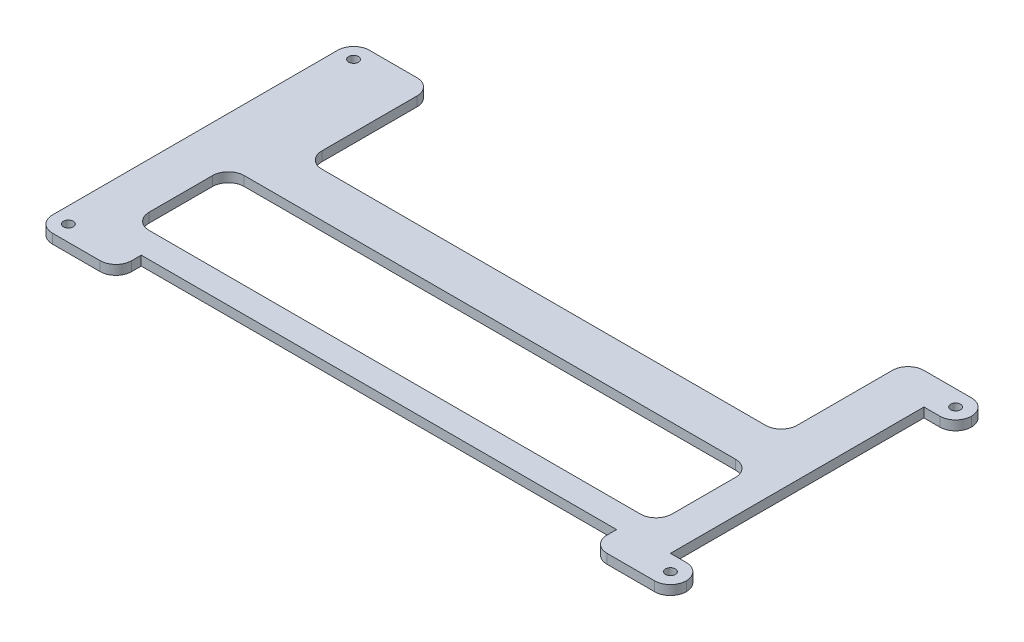
from build123d import *

# Parameters (mm, degrees)
SKETCH1_W           = 200
SKETCH1_H           = 100
BOSS_EXTRUDE1_DEPTH = 3
SKETCH2_R           = 1.55
CUT_EXTRUDE1_DEPTH  = 112.843640856
FILLET1_R           = 5
SKETCH3_W           = 150
SKETCH3_H           = 40
SKETCH3_W_2         = 10
SKETCH3_H_2         = 80
SKETCH3_H_3         = 8
SKETCH3_W_3         = 165
SKETCH3_H_4         = 30
CUT_EXTRUDE2_DEPTH  = 112.843640856
FILLET2_START       = -1
FILLET2_DEPTH       = 5
FILLET2_2_DEPTH     = 3


with BuildPart() as part:
    # Sketch1 → Boss-Extrude1 (new body)
    with BuildSketch(Plane(origin=(0, 0, 0), x_dir=(1, 0, 0), z_dir=(0, 1, 0))):
        Rectangle(SKETCH1_W, SKETCH1_H)
    extrude(amount=BOSS_EXTRUDE1_DEPTH)

    # Sketch2 → Cut-Extrude1 (cut, through all)
    with BuildSketch(Plane(origin=(0, 3, 0), x_dir=(1, 0, 0), z_dir=(0, 1, 0))):
        with Locations(Location((-95, 45, 0), (0, 0, 270))):
            Circle(SKETCH2_R)
        with Locations(Location((-95, -45, 0), (0, 0, 270))):
            Circle(SKETCH2_R)
        with Locations(Location((95, 45, 0), (0, 0, 270))):
            Circle(SKETCH2_R)
        with Locations(Location((95, -45, 0), (0, 0, 270))):
            Circle(SKETCH2_R)
    extrude(amount=-CUT_EXTRUDE1_DEPTH, mode=Mode.SUBTRACT)

    # Fillet1
    fillet1_edges = [part.edges().sort_by_distance(p)[0] for p in [
        (-100, 1.5, -50),
        (100, 1.5, -50),
        (100, 1.5, 50),
        (-100, 1.5, 50),
    ]]
    fillet(fillet1_edges, radius=FILLET1_R)

    # Sketch3 → Cut-Extrude2 (cut, through all)
    with BuildSketch(Plane(origin=(0, 3, 0), x_dir=(1, 0, 0), z_dir=(0, 1, 0))):
        with Locations((0, 30)):
            Rectangle(SKETCH3_W, SKETCH3_H)
        with Locations((95, 0)):
            Rectangle(SKETCH3_W_2, SKETCH3_H_2)
        with Locations((0, -46)):
            Rectangle(SKETCH3_W, SKETCH3_H_3)
        with Locations((-3, -19)):
            Rectangle(SKETCH3_W_3, SKETCH3_H_4)
    extrude(amount=-CUT_EXTRUDE2_DEPTH, mode=Mode.SUBTRACT)

    # Fillet2: read off the stored shape, not the designer's step
    # Fillet2 outline → Fillet2 (cut)
    with BuildSketch(Plane(origin=(0, 0, 0), x_dir=(1, 0, 0), z_dir=(0, 1, 0)).offset(FILLET2_START)):
        with BuildLine():
            Line((100, 40), (100, 45))
            ThreePointArc((100, 45), (98.535533906, 41.464466094), (95, 40))
            Line((95, 40), (100, 40))
        make_face()
        with BuildLine():
            ThreePointArc((-80, 50), (-76.464466094, 48.535533906), (-75, 45))
            Line((-75, 45), (-75, 50))
            Line((-75, 50), (-80, 50))
        make_face()
        with BuildLine():
            ThreePointArc((75, 45), (76.464466094, 48.535533906), (80, 50))
            Line((80, 50), (75, 50))
            Line((75, 50), (75, 45))
        make_face()
        with BuildLine():
            Line((100, -40), (95, -40))
            ThreePointArc((95, -40), (98.535533906, -41.464466094), (100, -45))
            Line((100, -45), (100, -40))
        make_face()
        with BuildLine():
            Line((75, -50), (80, -50))
            ThreePointArc((80, -50), (76.464466094, -48.535533906), (75, -45))
            Line((75, -45), (75, -50))
        make_face()
        with BuildLine():
            ThreePointArc((-75, -45), (-76.464466094, -48.535533906), (-80, -50))
            Line((-80, -50), (-75, -50))
            Line((-75, -50), (-75, -45))
        make_face()
    extrude(amount=FILLET2_DEPTH, mode=Mode.SUBTRACT)

    # Fillet2 2 outline → Fillet2 2 (add)
    with BuildSketch(Plane(origin=(0, 0, 0), x_dir=(1, 0, 0), z_dir=(0, 1, 0))):
        with BuildLine():
            Line((-75, 10), (-70, 10))
            ThreePointArc((-70, 10), (-73.535533906, 11.464466094), (-75, 15))
            Line((-75, 15), (-75, 10))
        make_face()
        with BuildLine():
            Line((75, 10), (75, 15))
            ThreePointArc((75, 15), (73.535533906, 11.464466094), (70, 10))
            Line((70, 10), (75, 10))
        make_face()
        with BuildLine():
            Line((79.5, -34), (79.5, -29))
            ThreePointArc((79.5, -29), (78.035533906, -32.535533906), (74.5, -34))
            Line((74.5, -34), (79.5, -34))
        make_face()
        with BuildLine():
            ThreePointArc((74.5, -4), (78.035533906, -5.464466094), (79.5, -9))
            Line((79.5, -9), (79.5, -4))
            Line((79.5, -4), (74.5, -4))
        make_face()
        with BuildLine():
            Line((-85.5, -34), (-80.5, -34))
            ThreePointArc((-80.5, -34), (-84.035533906, -32.535533906), (-85.5, -29))
            Line((-85.5, -29), (-85.5, -34))
        make_face()
        with BuildLine():
            ThreePointArc((-85.5, -9), (-84.035533906, -5.464466094), (-80.5, -4))
            Line((-80.5, -4), (-85.5, -4))
            Line((-85.5, -4), (-85.5, -9))
        make_face()
    extrude(amount=FILLET2_2_DEPTH)


solid = part.part
